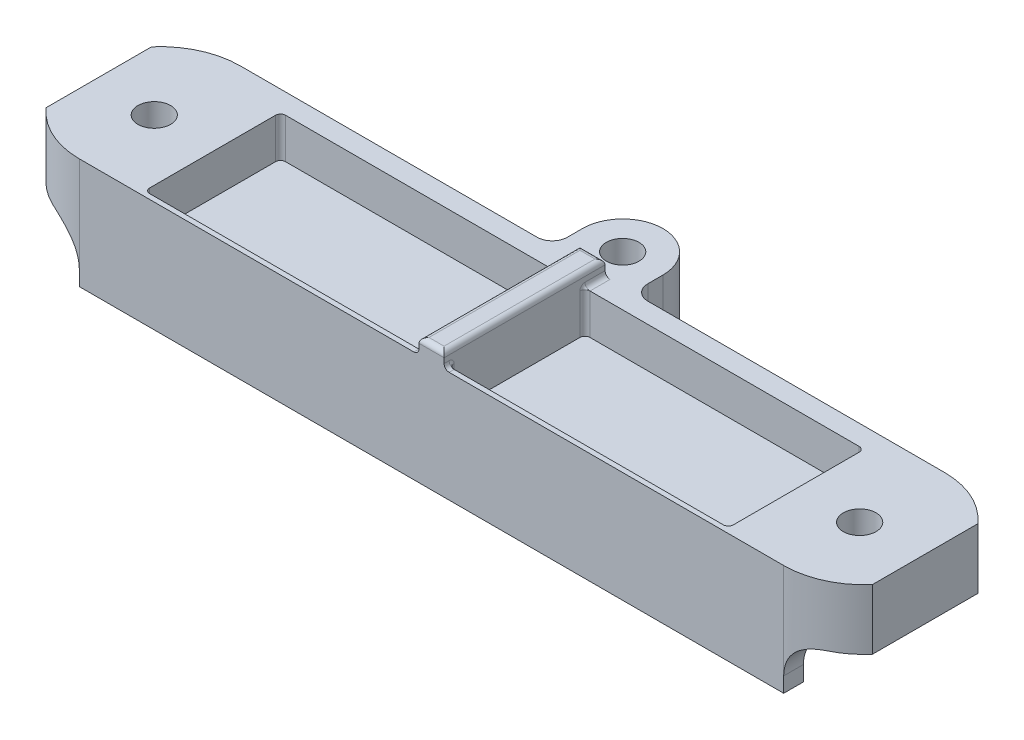
from build123d import *

# Parameters (mm, degrees)
SKETCH1_W           = 65
SKETCH1_H           = 32
BOSS_EXTRUDE1_DEPTH = 12
SKETCH10_R          = 3.25
BOLT_EXTRUDE_DEPTH  = 12
SKETCH7_W           = 58
SKETCH7_H           = 27
CUT_EXTRUDE5_DEPTH  = 8
SKETCH8_W           = 5
SKETCH8_H           = 32
BOSS_EXTRUDE3_DEPTH = 11
FILLET6_START       = 3
FILLET6_DEPTH       = 9
FILLET6_START_2     = -16
FILLET6_2_DEPTH     = 4
FILLET6_START_3     = 15
FILLET6_3_DEPTH     = 1
FILLET6_4_ANGLE     = 90
FILLET6_5_ANGLE     = 90
FILLET6_6_ANGLE     = 90
FILLET6_7_ANGLE     = 90
FILLET9_R           = 1
SKETCH11_W          = 120
SKETCH11_H          = 6.033066078
BOSS_EXTRUDE4_DEPTH = 10
SKETCH12_R          = 3.25
BOSS_EXTRUDE5_DEPTH = 12
FILLET11_R          = 7
FILLET12_R          = 3
FILLET13_R          = 3
FILLET15_R          = 1
FILLET16_R          = 1


with BuildPart() as part:
    # Sketch1 → Boss-Extrude1 (new body)
    with BuildSketch(Plane(origin=(0, 0, 0), x_dir=(1, 0, 0), z_dir=(0, 1, 0))):
        with Locations((-32.5, 0)):
            Rectangle(SKETCH1_W, SKETCH1_H)
    extrude(amount=BOSS_EXTRUDE1_DEPTH)

    # Sketch10 → bolt extrude (add)
    with BuildSketch(Plane(origin=(0, 12, 0), x_dir=(1, 0, 0), z_dir=(0, 1, 0))):
        with BuildLine():
            Line((-65, 16), (-70, 16))
            ThreePointArc((-70, 16), (-76.652203093, 14.551570156), (-82.1, 10.468524251))
            Line((-82.1, 10.468524251), (-82.1, -10.468524251))
            ThreePointArc((-82.1, -10.468524251), (-76.652203093, -14.551570156), (-70, -16))
            Line((-70, -16), (-65, -16))
            Line((-65, -16), (-65, 16))
        make_face()
        with Locations(Location((-70.1, -1, 0), (0, 0, 270))):
            Circle(SKETCH10_R, mode=Mode.SUBTRACT)
    extrude(amount=-BOLT_EXTRUDE_DEPTH)

    # Sketch7 → Cut-Extrude5 (cut)
    with BuildSketch(Plane(origin=(0, 12, 0), x_dir=(1, 0, 0), z_dir=(0, 1, 0))):
        with Locations((-29, -1.5)):
            Rectangle(SKETCH7_W, SKETCH7_H)
    extrude(amount=-CUT_EXTRUDE5_DEPTH, mode=Mode.SUBTRACT)

    # Mirror1: part across plane


with BuildPart() as part_1:
    add(part.part)
    add(part.part.mirror(Plane(origin=(0, 0, 0), x_dir=(0, 0, 1), z_dir=(1, 0, 0))))

    # Sketch8 → Boss-Extrude3 (add)
    with BuildSketch(Plane(origin=(0, 4, 0), x_dir=(1, 0, 0), z_dir=(0, 1, 0))):
        Rectangle(SKETCH8_W, SKETCH8_H)
    extrude(amount=BOSS_EXTRUDE3_DEPTH)

    # Fillet6: read off the stored shape, not the designer's step
    # Fillet6 outline → Fillet6 (add)
    with BuildSketch(Plane(origin=(0, 0, 0), x_dir=(1, 0, 0), z_dir=(0, 1, 0)).offset(FILLET6_START)):
        with BuildLine():
            Line((-2.5, -15), (-2.5, -14))
            ThreePointArc((-2.5, -14), (-2.792893219, -14.707106781), (-3.5, -15))
            Line((-3.5, -15), (-2.5, -15))
        make_face()
        with BuildLine():
            ThreePointArc((-3.5, 12), (-2.792893219, 11.707106781), (-2.5, 11))
            Line((-2.5, 11), (-2.5, 12))
            Line((-2.5, 12), (-3.5, 12))
        make_face()
        with BuildLine():
            Line((-58, -15), (-57, -15))
            ThreePointArc((-57, -15), (-57.707106781, -14.707106781), (-58, -14))
            Line((-58, -14), (-58, -15))
        make_face()
        with BuildLine():
            ThreePointArc((-58, 11), (-57.707106781, 11.707106781), (-57, 12))
            Line((-57, 12), (-58, 12))
            Line((-58, 12), (-58, 11))
        make_face()
        with BuildLine():
            Line((2.5, -14), (2.5, -15))
            Line((2.5, -15), (3.5, -15))
            ThreePointArc((3.5, -15), (2.792893219, -14.707106781), (2.5, -14))
        make_face()
        with BuildLine():
            Line((3.5, 12), (2.5, 12))
            Line((2.5, 12), (2.5, 11))
            ThreePointArc((2.5, 11), (2.792893219, 11.707106781), (3.5, 12))
        make_face()
        with BuildLine():
            ThreePointArc((58, -14), (57.707106781, -14.707106781), (57, -15))
            Line((57, -15), (58, -15))
            Line((58, -15), (58, -14))
        make_face()
        with BuildLine():
            Line((58, 12), (57, 12))
            ThreePointArc((57, 12), (57.707106781, 11.707106781), (58, 11))
            Line((58, 11), (58, 12))
        make_face()
    extrude(amount=FILLET6_DEPTH)

    # Fillet6 2 outline → Fillet6 2 (add)
    with BuildSketch(Plane.XY.offset(FILLET6_START_2)):
        with BuildLine():
            Line((-2.5, 12), (-2.5, 13))
            ThreePointArc((-2.5, 13), (-2.792893219, 12.292893219), (-3.5, 12))
            Line((-3.5, 12), (-2.5, 12))
        make_face()
        with BuildLine():
            ThreePointArc((3.5, 12), (2.792893219, 12.292893219), (2.5, 13))
            Line((2.5, 13), (2.5, 12))
            Line((2.5, 12), (3.5, 12))
        make_face()
    extrude(amount=FILLET6_2_DEPTH)

    # Fillet6 3 outline → Fillet6 3 (add)
    with BuildSketch(Plane.XY.offset(FILLET6_START_3)):
        with BuildLine():
            Line((-2.5, 12), (-2.5, 13))
            ThreePointArc((-2.5, 13), (-2.792893219, 12.292893219), (-3.5, 12))
            Line((-3.5, 12), (-2.5, 12))
        make_face()
        with BuildLine():
            ThreePointArc((3.5, 12), (2.792893219, 12.292893219), (2.5, 13))
            Line((2.5, 13), (2.5, 12))
            Line((2.5, 12), (3.5, 12))
        make_face()
    extrude(amount=FILLET6_3_DEPTH)

    # Fillet6 4 outline → Fillet6 4 (revolve)
    with BuildSketch(Plane(origin=(0, 12, 15), x_dir=(0, 0, -1), z_dir=(0, -1, 0))):
        with BuildLine():
            ThreePointArc((0, -3.5), (0.292893219, -2.792893219), (1, -2.5))
            Line((1, -2.5), (0, -2.5))
            Line((0, -2.5), (0, -3.5))
        make_face()
    revolve(axis=Axis((0, 12, 15), (1, 0, 0)), revolution_arc=FILLET6_4_ANGLE)

    # Fillet6 5 outline → Fillet6 5 (revolve)
    with BuildSketch(Plane(origin=(0, 12, -12), x_dir=(0, 1, 0), z_dir=(0, 0, -1))):
        with BuildLine():
            ThreePointArc((0, -3.5), (0.292893219, -2.792893219), (1, -2.5))
            Line((1, -2.5), (0, -2.5))
            Line((0, -2.5), (0, -3.5))
        make_face()
    revolve(axis=Axis((0, 12, -12), (1, 0, 0)), revolution_arc=FILLET6_5_ANGLE)

    # Fillet6 6 outline → Fillet6 6 (revolve)
    with BuildSketch(Plane(origin=(0, 12, -12), x_dir=(0, 1, 0), z_dir=(0, 0, -1))):
        with BuildLine():
            Line((0, 2.5), (1, 2.5))
            ThreePointArc((1, 2.5), (0.292893219, 2.792893219), (0, 3.5))
            Line((0, 3.5), (0, 2.5))
        make_face()
    revolve(axis=Axis((0, 12, -12), (1, 0, 0)), revolution_arc=FILLET6_6_ANGLE)

    # Fillet6 7 outline → Fillet6 7 (revolve)
    with BuildSketch(Plane(origin=(0, 12, 15), x_dir=(0, 0, -1), z_dir=(0, -1, 0))):
        with BuildLine():
            Line((0, 2.5), (1, 2.5))
            ThreePointArc((1, 2.5), (0.292893219, 2.792893219), (0, 3.5))
            Line((0, 3.5), (0, 2.5))
        make_face()
    revolve(axis=Axis((0, 12, 15), (1, 0, 0)), revolution_arc=FILLET6_7_ANGLE)

    # Fillet9
    fillet9_edges = [part_1.edges().sort_by_distance(p)[0] for p in [
        (2.5, 15, 0),
        (0, 15, -16),
        (-2.5, 15, 0),
        (0, 15, 16),
    ]]
    fillet(fillet9_edges, radius=FILLET9_R)

    # Sketch11 → Boss-Extrude4 (add)
    with BuildSketch(Plane.XZ):
        Polygon((70.002161454, 12.077158354), (-70.005398194, 12), (-70, 16), (70, 16), align=None)
        Rectangle(SKETCH11_W, SKETCH11_H)
        Polygon((70.002161454, -12.077158354), (70, -16), (-70, -16), (-70.005398194, -12), align=None)
    extrude(amount=BOSS_EXTRUDE4_DEPTH)

    # Sketch12 → Boss-Extrude5 (add)
    with BuildSketch(Plane.XZ):
        with BuildLine():
            Line((-8, -12), (-8, -22))
            ThreePointArc((-8, -22), (0, -30), (8, -22))
            Line((8, -22), (8, -12))
            Line((8, -12), (-8, -12))
        make_face()
        with Locations(Location((0, -22, 0), (0, 0, 270))):
            Circle(SKETCH12_R, mode=Mode.SUBTRACT)
    extrude(amount=-BOSS_EXTRUDE5_DEPTH)

    # Fillet11
    fillet11_edges = [part_1.edges().sort_by_distance(p)[0] for p in [
        (-70.002699097, 0, -14),
        (70.001080727, 0, -14.038579177),
        (-70.002699097, 0, 14),
        (70.001080727, 0, 14.038579177),
    ]]
    fillet(fillet11_edges, radius=FILLET11_R)

    # Fillet12
    fillet12_edges = [part_1.edges().sort_by_distance(p)[0] for p in [
        (0, 0, 3.016533039),
        (0, 0, -3.016533039),
        (-0.001624692, 0, 12.038579173),
        (-0.001624692, 0, -12.038579173),
    ]]
    fillet(fillet12_edges, radius=FILLET12_R)

    # Fillet13
    fillet13_edges = [part_1.edges().sort_by_distance(p)[0] for p in [
        (-8, 6, -16),
        (8, 6, -16),
    ]]
    fillet(fillet13_edges, radius=FILLET13_R)

    # Fillet15
    fillet15_edges = [part_1.edges().sort_by_distance(p)[0] for p in [
        (0, 0, -16),
    ]]
    fillet(fillet15_edges, radius=FILLET15_R)

    # Fillet16
    fillet16_edges = [part_1.edges().sort_by_distance(p)[0] for p in [
        (60, 0, 0),
        (-60, 0, 0),
    ]]
    fillet(fillet16_edges, radius=FILLET16_R)


solid = part_1.part
